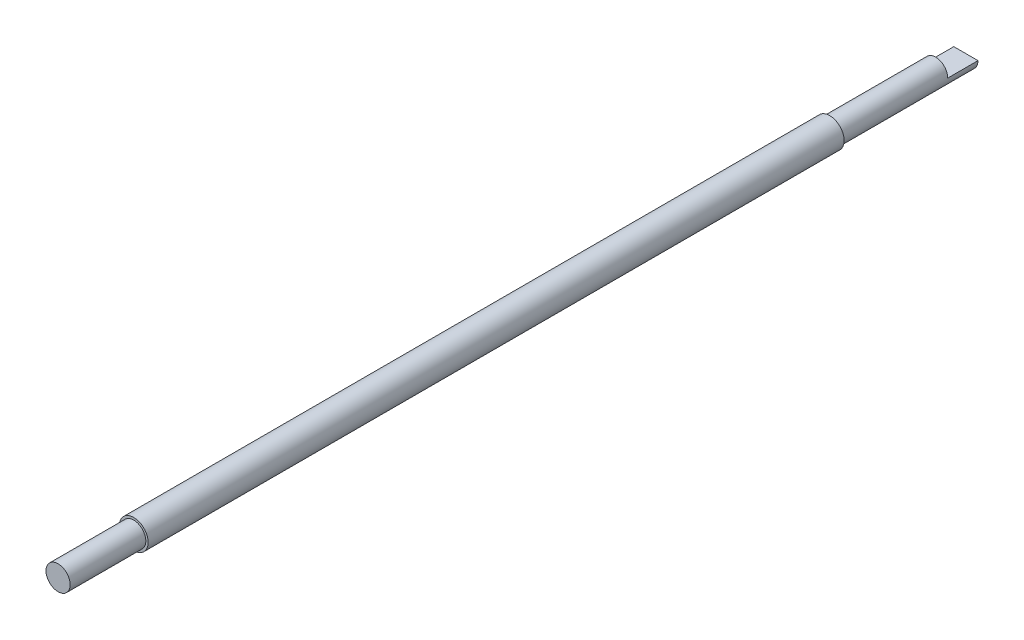
from build123d import *

# Parameters (mm, degrees)
SKETCH1_R           = 4.7625
BOSS_EXTRUDE1_DEPTH = 300
SKETCH3_R           = 4.7625
SKETCH3_R_2         = 4
CUT_EXTRUDE2_DEPTH  = 45
CUT_EXTRUDE3_DEPTH  = 10
CUT_EXTRUDE4_START  = -25
SKETCH5_R           = 4.7625
SKETCH5_R_2         = 4
CUT_EXTRUDE4_DEPTH  = 25


with BuildPart() as part:
    # Sketch1 → Boss-Extrude1 (new body)
    with BuildSketch(Plane.XY):
        Circle(SKETCH1_R)
    extrude(amount=BOSS_EXTRUDE1_DEPTH)

    # Sketch3 → Cut-Extrude2 (cut)
    with BuildSketch(Plane(origin=(0, 0, 0), x_dir=(-1, 0, 0), z_dir=(0, 0, -1))):
        Circle(SKETCH3_R)
        Circle(SKETCH3_R_2, mode=Mode.SUBTRACT)
    extrude(amount=-CUT_EXTRUDE2_DEPTH, mode=Mode.SUBTRACT)

    # Sketch4 → Cut-Extrude3 (cut)
    with BuildSketch(Plane(origin=(0, 0, 0), x_dir=(-1, 0, 0), z_dir=(0, 0, -1))):
        with BuildLine():
            ThreePointArc((4, 0), (0, 4), (-4, 0))
            Line((-4, 0), (4, 0))
        make_face()
    extrude(amount=-CUT_EXTRUDE3_DEPTH, mode=Mode.SUBTRACT)

    # Sketch5 → Cut-Extrude4 (cut)
    with BuildSketch(Plane.XY.offset(300).offset(CUT_EXTRUDE4_START)):
        Circle(SKETCH5_R)
        Circle(SKETCH5_R_2, mode=Mode.SUBTRACT)
    extrude(amount=CUT_EXTRUDE4_DEPTH, mode=Mode.SUBTRACT)


solid = part.part
